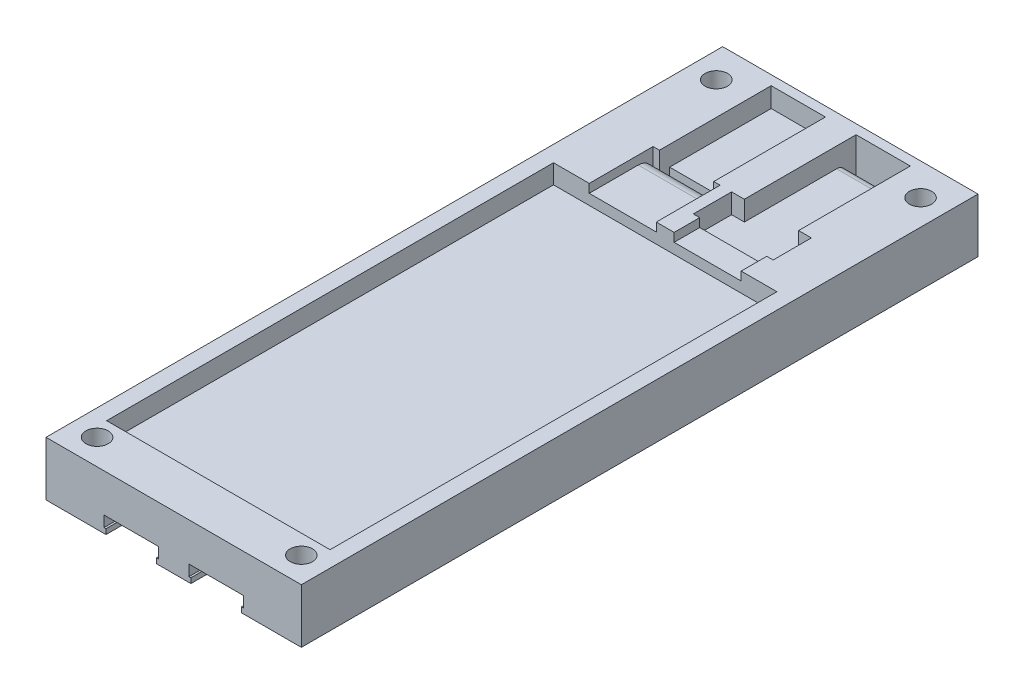
from build123d import *

# Parameters (mm, degrees)
SKETCH1_W                  = 40
SKETCH1_H                  = 106
BOSS_EXTRUDE1_DEPTH        = 8.5
SKETCH2_W                  = 35
SKETCH2_H                  = 70
CUT_EXTRUDE1_DEPTH         = 3
SKETCH3_W                  = 10.5
SKETCH3_H                  = 10
CUT_EXTRUDE2_DEPTH         = 1.35
SKETCH4_W                  = 12.5
SKETCH4_H                  = 6
CUT_EXTRUDE3_DEPTH         = 3.1
SKETCH5_W                  = 8.5
SKETCH5_H                  = 17.5
PCB_PLACE_DEPTH            = 3.1
SKETCH6_W                  = 8.5
SKETCH6_H                  = 1.6
NICKEL_STRIP_HOLE_DEPTH    = 70.174850921
CUT_EXTRUDE4_REACH         = 71.486
SKETCH7_W                  = 8.5
SKETCH7_H                  = 17.5
SKETCH8_W                  = 8.5
SKETCH8_H                  = 1.6
CUT_EXTRUDE5_DEPTH         = 10
SKETCH9_W                  = 8.5
SKETCH9_H                  = 106
NICKEL_STRIP_RAIL_DEPTH    = 2.5
FILLET3_R                  = 2.325
FILLET4_RADIUS             = 1.45
FILLET4_LENGTH             = 8.5
SKETCH10_W                 = 8.5
SKETCH10_H                 = 5
CUT_EXTRUDE6_DEPTH         = 1.5
SKETCH11_W                 = 8.5
SKETCH11_H                 = 0.7
NICKELSTRIPINSERTION_DEPTH = 18
FILLET5_INSERTION_START    = -10.9
FILLET5_INSERTION_DEPTH    = 8.5
FILLET5_INSERTION_START_2  = 2.4
FILLET5_INSERTION_2_DEPTH  = 8.5
FILLET7_AMEND_R            = 4
FILLET6_START              = -10.9
FILLET6_DEPTH              = 8.5
FILLET6_START_2            = 2.4
FILLET6_2_DEPTH            = 8.5
FILLET8_ROUNDING_R         = 0.1
SKETCH12_W                 = 0.3
SKETCH12_H                 = 0.8
STRIPRAIL_DEPTH            = 70
SKETCH13_R                 = 1.75
SCREW_HOLES_DEPTH          = 70.485610128
SKETCH14_R                 = 3.5
SCREW_HEAD_HOLES_TBM_DEPTH = 3.5


with BuildPart() as part:
    # Sketch1 → Boss-Extrude1 (new body)
    with BuildSketch(Plane(origin=(0, 0, 0), x_dir=(1, 0, 0), z_dir=(0, 1, 0))):
        with Locations((0, 13)):
            Rectangle(SKETCH1_W, SKETCH1_H)
    extrude(amount=BOSS_EXTRUDE1_DEPTH)

    # Sketch2 → Cut-Extrude1 (cut)
    with BuildSketch(Plane(origin=(0, 8.5, 0), x_dir=(1, 0, 0), z_dir=(0, 1, 0))):
        with Locations((0, 2)):
            Rectangle(SKETCH2_W, SKETCH2_H)
    extrude(amount=-CUT_EXTRUDE1_DEPTH, mode=Mode.SUBTRACT)

    # Sketch3 → Cut-Extrude2 (cut)
    with BuildSketch(Plane(origin=(0, 8.5, 0), x_dir=(1, 0, 0), z_dir=(0, 1, 0))):
        with Locations((-6.65, 42)):
            Rectangle(SKETCH3_W, SKETCH3_H)
        with Locations((6.65, 42)):
            Rectangle(SKETCH3_W, SKETCH3_H)
    extrude(amount=-CUT_EXTRUDE2_DEPTH, mode=Mode.SUBTRACT)

    # Sketch4 → Cut-Extrude3 (cut)
    with BuildSketch(Plane(origin=(0, 8.5, 0), x_dir=(1, 0, 0), z_dir=(0, 1, 0))):
        with Locations((6.65, 44)):
            Rectangle(SKETCH4_W, SKETCH4_H)
    extrude(amount=-CUT_EXTRUDE3_DEPTH, mode=Mode.SUBTRACT)

    # Sketch5 → PCB place (cut)
    with BuildSketch(Plane(origin=(0, 8.5, 0), x_dir=(1, 0, 0), z_dir=(0, 1, 0))):
        with Locations((6.65, 55.75)):
            Rectangle(SKETCH5_W, SKETCH5_H)
    extrude(amount=-PCB_PLACE_DEPTH, mode=Mode.SUBTRACT)

    # Sketch6 → Nickel strip hole (cut, through all)
    with BuildSketch(Plane(origin=(0, 5.4, 0), x_dir=(1, 0, 0), z_dir=(0, 1, 0))):
        with Locations((6.65, 63.7)):
            Rectangle(SKETCH6_W, SKETCH6_H)
    extrude(amount=-NICKEL_STRIP_HOLE_DEPTH, mode=Mode.SUBTRACT)

    # Cut-Extrude4: up to this face of the body (flat: up to its plane)
    cut_extrude4_end = Plane(part.part.faces().sort_by_distance((6.65, 5.4, -51.042077088))[0])
    # Sketch7 → Cut-Extrude4 (cut, up to the picked face)
    with BuildSketch(Plane(origin=(0, 8.5, 0), x_dir=(1, 0, 0), z_dir=(0, 1, 0)), mode=Mode.PRIVATE) as cut_extrude4_sk1:
        with Locations((-6.65, 55.75)):
            Rectangle(SKETCH7_W, SKETCH7_H)
    cut_extrude4_tool1 = split(extrude(cut_extrude4_sk1.sketch, amount=-CUT_EXTRUDE4_REACH, mode=Mode.PRIVATE), bisect_by=cut_extrude4_end, keep=Keep.BOTH, mode=Mode.PRIVATE)
    add(cut_extrude4_tool1.solids().sort_by(Axis((-6.65, 8.5, -55.75), (0, -1, 0)))[0], mode=Mode.SUBTRACT)

    # Sketch8 → Cut-Extrude5 (cut)
    with BuildSketch(Plane(origin=(0, 5.4, 0), x_dir=(1, 0, 0), z_dir=(0, 1, 0))):
        with Locations((-6.65, 47.8)):
            Rectangle(SKETCH8_W, SKETCH8_H)
    extrude(amount=-CUT_EXTRUDE5_DEPTH, mode=Mode.SUBTRACT)

    # Sketch9 → Nickel strip rail (cut)
    with BuildSketch(Plane.XZ):
        with Locations((-6.65, -13)):
            Rectangle(SKETCH9_W, SKETCH9_H)
        with Locations((6.65, -13)):
            Rectangle(SKETCH9_W, SKETCH9_H)
    extrude(amount=-NICKEL_STRIP_RAIL_DEPTH, mode=Mode.SUBTRACT)

    # Fillet3
    # the kernel refuses this fillet: 2.325 mm, written as the material it takes off along each edge
    with BuildSketch(Plane(origin=(3.4125, 7.15, -47), x_dir=(0, 0, 1), z_dir=(-1, 0, 0))) as fillet3_piece_1_section:
        with BuildLine():
            CenterArc((FILLET3_R, -FILLET3_R), FILLET3_R, 90, 90)
            Line((0, -FILLET3_R), (0, 0))
            Line((0, 0), (FILLET3_R, 0))
        make_face()
    fillet3_piece_1 = extrude(amount=20.125, mode=Mode.PRIVATE)
    fillet3_piece_1 = split(fillet3_piece_1, bisect_by=Plane(origin=(-11.9, 7.15, -47), z_dir=(1, 0, 0)), keep=Keep.TOP, mode=Mode.PRIVATE)
    fillet3_piece_1 = split(fillet3_piece_1, bisect_by=Plane(origin=(-1.4, 7.15, -47), z_dir=(-1, 0, 0)), keep=Keep.TOP, mode=Mode.PRIVATE)
    add(fillet3_piece_1, mode=Mode.SUBTRACT)
    with BuildSketch(Plane(origin=(-10.9, 2.5, -47), x_dir=(0, 1, 0), z_dir=(1, 0, 0))) as fillet3_piece_2:
        with BuildLine():
            CenterArc((FILLET3_R, FILLET3_R), FILLET3_R, 180, 90)
            Line((0, FILLET3_R), (0, 0))
            Line((0, 0), (FILLET3_R, 0))
        make_face()
    extrude(amount=8.5, mode=Mode.SUBTRACT)

    # Fillet4: full round fillet: the end face becomes a half cylinder, R = half its width
    fillet4_face = Plane((6.65, 3.95, -62.9), x_dir=(1, 0, 0), z_dir=(0, 0, -1))  # on the end face: x along it, z out of the body
    fillet4_slab = fillet4_face.offset(-FILLET4_RADIUS / 2) * Box(FILLET4_LENGTH, 2 * FILLET4_RADIUS, FILLET4_RADIUS, mode=Mode.PRIVATE)  # the body's end, R deep
    fillet4_round = Plane((6.65, 3.95, -61.45), x_dir=(0, 0, -1), z_dir=(1, 0, 0)) * Cylinder(FILLET4_RADIUS, FILLET4_LENGTH, mode=Mode.PRIVATE)  # its axis R under the face
    add(fillet4_slab - fillet4_round, mode=Mode.SUBTRACT)

    # Sketch10 → Cut-Extrude6 (cut)
    with BuildSketch(Plane.XZ.offset(-2.5)):
        with Locations((6.65, 6.5)):
            Rectangle(SKETCH10_W, SKETCH10_H)
        with Locations((-6.65, 6.5)):
            Rectangle(SKETCH10_W, SKETCH10_H)
    extrude(amount=-CUT_EXTRUDE6_DEPTH, mode=Mode.SUBTRACT)

    # Sketch11 → NickelStripInsertion (cut)
    with BuildSketch(Plane(origin=(0, 0, 9), x_dir=(-1, 0, 0), z_dir=(0, 0, -1))):
        with Locations((-6.65, 3.65)):
            Rectangle(SKETCH11_W, SKETCH11_H)
        with Locations((6.65, 3.65)):
            Rectangle(SKETCH11_W, SKETCH11_H)
    extrude(amount=-NICKELSTRIPINSERTION_DEPTH, mode=Mode.SUBTRACT)

    # Fillet5_insertion: read off the stored shape, not the designer's step
    # Fillet5_insertion outline → Fillet5_insertion (cut)
    with BuildSketch(Plane.YZ.offset(FILLET5_INSERTION_START)):
        with BuildLine():
            Line((2.5, 4), (2.5, -8.359207094))
            add(Edge.make_bspline(
                [(2.5, -8.359207094), (2.5, 2.968380423), (4, 4)],
                knots=[0, 0, 0, 1, 1, 1], degree=2, weights=[1, 0.885061203, 1]))
            Line((4, 4), (2.5, 4))
        make_face()
    extrude(amount=FILLET5_INSERTION_DEPTH, mode=Mode.SUBTRACT)

    # Fillet5_insertion 2 outline → Fillet5_insertion 2 (cut)
    with BuildSketch(Plane.YZ.offset(FILLET5_INSERTION_START_2)):
        with BuildLine():
            Line((2.5, 4), (2.5, -8.359207094))
            add(Edge.make_bspline(
                [(2.5, -8.359207094), (2.5, 2.968380423), (4, 4)],
                knots=[0, 0, 0, 1, 1, 1], degree=2, weights=[1, 0.885061203, 1]))
            Line((4, 4), (2.5, 4))
        make_face()
    extrude(amount=FILLET5_INSERTION_2_DEPTH, mode=Mode.SUBTRACT)

    # Fillet7_amend
    fillet7_amend_edges = [part.edges().sort_by_distance(p)[0] for p in [
        (6.65, 4, 4),
        (-6.65, 4, 4),
    ]]
    fillet(fillet7_amend_edges, radius=FILLET7_AMEND_R)

    # Fillet6: read off the stored shape, not the designer's step
    # Fillet6 outline → Fillet6 (cut)
    with BuildSketch(Plane.YZ.offset(FILLET6_START)):
        with BuildLine():
            Line((3.3, 9), (3.3, 16.909487973))
            add(Edge.make_bspline(
                [(3.3, 16.909487973), (3.3, 9.121373217), (2.5, 9)],
                knots=[0, 0, 0, 1, 1, 1], degree=2, weights=[1, 0.758287544, 1]))
            Line((2.5, 9), (3.3, 9))
        make_face()
    extrude(amount=FILLET6_DEPTH, mode=Mode.SUBTRACT)

    # Fillet6 2 outline → Fillet6 2 (cut)
    with BuildSketch(Plane.YZ.offset(FILLET6_START_2)):
        with BuildLine():
            Line((3.3, 9), (3.3, 16.909487973))
            add(Edge.make_bspline(
                [(3.3, 16.909487973), (3.3, 9.121373217), (2.5, 9)],
                knots=[0, 0, 0, 1, 1, 1], degree=2, weights=[1, 0.758287544, 1]))
            Line((2.5, 9), (3.3, 9))
        make_face()
    extrude(amount=FILLET6_2_DEPTH, mode=Mode.SUBTRACT)

    # Fillet8_rounding
    fillet8_rounding_edges = [part.edges().sort_by_distance(p)[0] for p in [
        (-6.65, 2.5, 9),
        (6.65, 2.5, 9),
    ]]
    fillet(fillet8_rounding_edges, radius=FILLET8_ROUNDING_R)

    # Sketch12 → StripRail (add)
    with BuildSketch(Plane.XY.offset(40)):
        with Locations((2.55, 0.4)):
            Rectangle(SKETCH12_W, SKETCH12_H)
        with Locations((-10.75, 0.4)):
            Rectangle(SKETCH12_W, SKETCH12_H)
        with Locations((-2.55, 0.4)):
            Rectangle(SKETCH12_W, SKETCH12_H)
        with Locations((10.75, 0.4)):
            Rectangle(SKETCH12_W, SKETCH12_H)
    extrude(amount=-STRIPRAIL_DEPTH)

    # Sketch13 → Screw_Holes (cut, through all)
    with BuildSketch(Plane.XZ):
        with Locations(Location((-16, -61, 0), (0, 0, 270))):
            Circle(SKETCH13_R)
        with Locations(Location((16, -61, 0), (0, 0, 270))):
            Circle(SKETCH13_R)
        with Locations(Location((-16, 36, 0), (0, 0, 270))):
            Circle(SKETCH13_R)
        with Locations(Location((16, 36, 0), (0, 0, 270))):
            Circle(SKETCH13_R)
    extrude(amount=-SCREW_HOLES_DEPTH, mode=Mode.SUBTRACT)

    # Sketch14 → Screw_Head_Holes_TBM (cut)
    with BuildSketch(Plane.XZ):
        with Locations(Location((16, -61, 0), (0, 0, 270))):
            Circle(SKETCH14_R)
        with Locations(Location((-16, -61, 0), (0, 0, 270))):
            Circle(SKETCH14_R)
        with Locations(Location((16, 36, 0), (0, 0, 270))):
            Circle(SKETCH14_R)
        with Locations(Location((-16, 36, 0), (0, 0, 270))):
            Circle(SKETCH14_R)
    extrude(amount=-SCREW_HEAD_HOLES_TBM_DEPTH, mode=Mode.SUBTRACT)


solid = part.part
